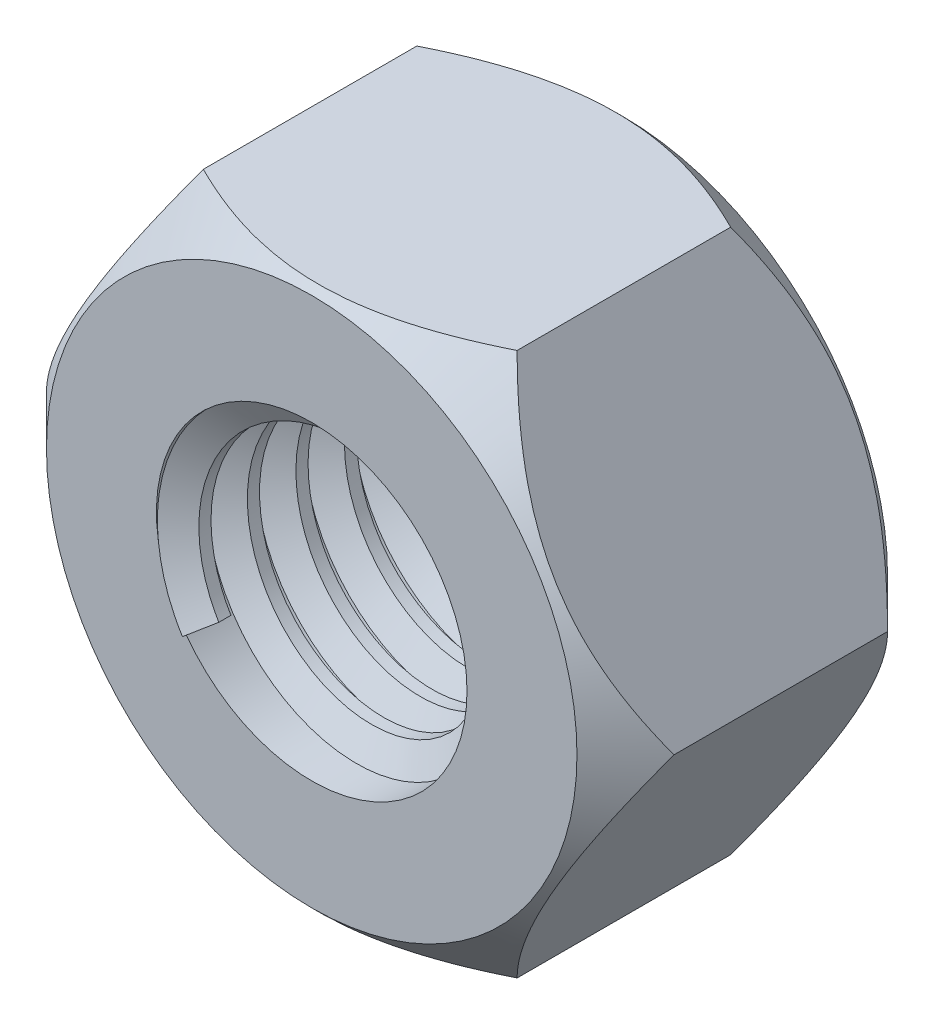
from build123d import *

# Parameters (mm, degrees)
BOSS_EXTRUDE1_DEPTH   = 4
F_8_0MM_DOWEL_HOLE2_D = 8
THREAD1_PITCH         = 1.25


with BuildPart() as part:
    # Sketch1 → Boss-Extrude1 (new, symmetric)
    with BuildSketch(Plane.XY):
        Polygon((-4.041451884, -7), (4.041451884, -7), (8.082903769, 0), (4.041451884, 7), (-4.041451884, 7), (-8.082903769, 0), align=None)
    extrude(amount=BOSS_EXTRUDE1_DEPTH, both=True)

    # Sketch3 → Cut-Revolve1 (revolve, cut)
    with BuildSketch(Plane(origin=(0, 0, 0), x_dir=(1, 0, 0), z_dir=(0, 1, 0))):
        Polygon((-6.832903769, 4), (-8.082903769, 4), (-8.082903769, 2.75), align=None)
        Polygon((-8.082903769, -4), (-8.082903769, -2.75), (-6.832903769, -4), align=None)
    revolve(axis=Axis((0, 0, -5.274823834), (0, 0, 1)), mode=Mode.SUBTRACT)

    # Ø8.0mm Dowel Hole2 (through all)
    with Locations(Plane(origin=(0, 0, -4), x_dir=(-1, 0, 0), z_dir=(0, 0, -1))):
        with Locations((0, 0)):
            Hole(F_8_0MM_DOWEL_HOLE2_D / 2)

    # Thread1: the profile of Thread Profile3 profile screwed along a right-hand helix of 5.6 turns, 8 arcs to a turn; built about Z, then put on its axis
    thread1_z = Axis((0, 0, 0), (0, 0, 1))
    thread1_corners = [(4.0003, 0, -0.000173205), (4.0003, 0, 1.093923202), (3.323417656, 0, 0.703124998), (3.323417656, 0, 0.390624998)]
    with BuildLine(mode=Mode.PRIVATE) as thread1_profile:
        Line(thread1_corners[0], thread1_corners[1])
        Line(thread1_corners[1], thread1_corners[2])
        Line(thread1_corners[2], thread1_corners[3])
        Line(thread1_corners[3], thread1_corners[0])
    thread1_cap = Face(thread1_profile.wire())
    thread1_turn_angles = [0, 22.5, 45, 67.5, 90, 112.5, 135, 157.5, 180, 202.5, 225, 247.5, 270, 292.5, 315, 337.5, 360]
    thread1_turn_weights = [1, 0.9238795325112867, 1, 0.9238795325112867, 1, 0.9238795325112867, 1, 0.9238795325112867, 1, 0.9238795325112867, 1, 0.9238795325112867, 1, 0.9238795325112867, 1, 0.9238795325112867, 1]
    thread1_turn_rails = [Edge.make_bspline([Vector(p[0], p[1], 0).rotate(thread1_z, thread1_turn_angles[k]) / thread1_turn_weights[k] + Vector(0, 0, p[2] + THREAD1_PITCH * thread1_turn_angles[k] / 360) for k in range(17)], [0, 0, 0, 1, 1, 2, 2, 3, 3, 4, 4, 5, 5, 6, 6, 7, 7, 8, 8, 8], 2, thread1_turn_weights) for p in thread1_corners]
    thread1_turn_sides = [Face.make_surface_from_curves(thread1_turn_rails[p[0]], thread1_turn_rails[p[1]]) for p in [(0, 1), (1, 2), (2, 3), (3, 0)]]
    thread1_last_angles = [1800, 1822.5, 1845, 1867.5, 1890, 1912.5, 1935, 1957.5, 1980, 1998, 2016]
    thread1_last_weights = [1, 0.9238795325112867, 1, 0.9238795325112867, 1, 0.9238795325112867, 1, 0.9238795325112867, 1, 0.9510565162951535, 1]
    thread1_last_rails = [Edge.make_bspline([Vector(p[0], p[1], 0).rotate(thread1_z, thread1_last_angles[k]) / thread1_last_weights[k] + Vector(0, 0, p[2] + THREAD1_PITCH * thread1_last_angles[k] / 360) for k in range(11)], [0, 0, 0, 1, 1, 2, 2, 3, 3, 4, 4, 5, 5, 5], 2, thread1_last_weights) for p in thread1_corners]
    thread1_last_sides = [Face.make_surface_from_curves(thread1_last_rails[p[0]], thread1_last_rails[p[1]]) for p in [(0, 1), (1, 2), (2, 3), (3, 0)]]
    thread1 = Plane(origin=(0, 0, -4), x_dir=(1, 0, 0), z_dir=(0, 0, 1)) * Solid(Shell([*[p.moved(Location((0, 0, THREAD1_PITCH * i))) for i in range(5) for p in thread1_turn_sides], *thread1_last_sides, thread1_cap, thread1_cap.rotate(thread1_z, 2016).moved(Location((0, 0, THREAD1_PITCH * 2016 / 360)))]))
    add(thread1)


solid = part.part
